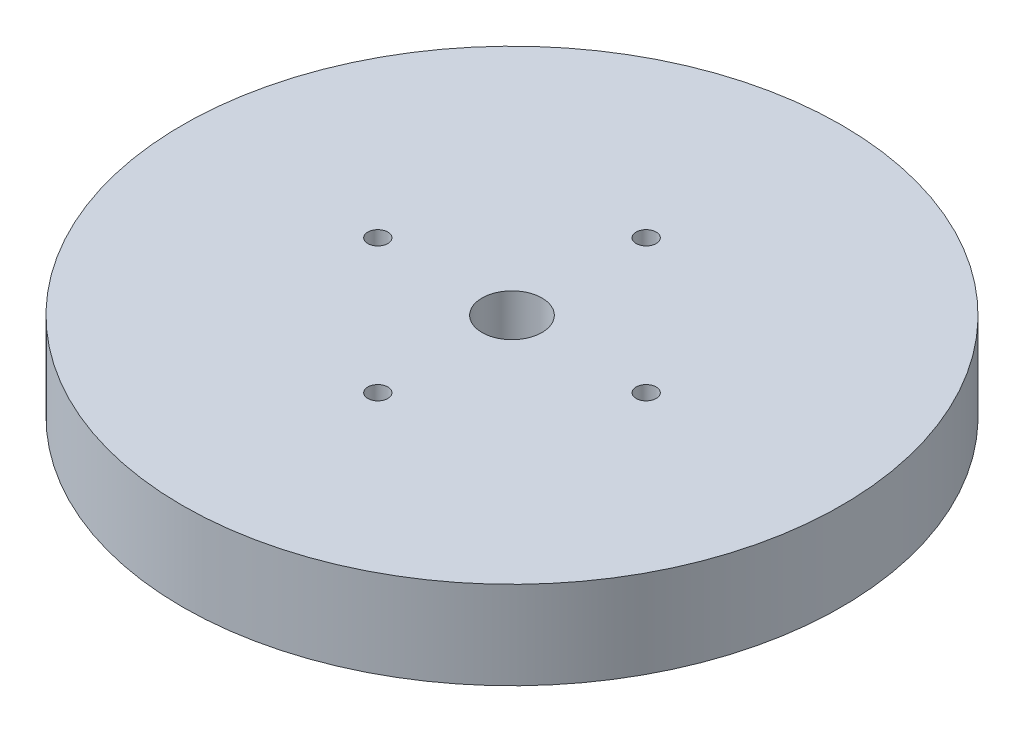
from build123d import *

# Parameters (mm, degrees)
SKETCH1_R           = 82.5
BOSS_EXTRUDE1_DEPTH = 22
SKETCH2_R           = 7.5
CUT_EXTRUDE1_DEPTH  = 119.728682297
SKETCH3_R           = 2.506035233
CUT_EXTRUDE2_DEPTH  = 15.316390653
CIRPATTERN1_COUNT   = 4


with BuildPart() as part:
    # Sketch1 → Boss-Extrude1 (new body)
    with BuildSketch(Plane(origin=(0, 0, 0), x_dir=(1, 0, 0), z_dir=(0, 1, 0))):
        Circle(SKETCH1_R)
    extrude(amount=BOSS_EXTRUDE1_DEPTH)

    # Sketch2 → Cut-Extrude1 (cut, through all)
    with BuildSketch(Plane(origin=(0, 0, 0), x_dir=(1, 0, 0), z_dir=(0, 1, 0))):
        Circle(SKETCH2_R)
    extrude(amount=CUT_EXTRUDE1_DEPTH, mode=Mode.SUBTRACT)

    # Sketch3 → Cut-Extrude2 (cut)
    with BuildSketch(Plane(origin=(0, 22, 0), x_dir=(1, 0, 0), z_dir=(0, 1, 0))):
        with Locations((-33.586704901, 0)):
            Circle(SKETCH3_R)
    cut_extrude2 = extrude(amount=-CUT_EXTRUDE2_DEPTH, mode=Mode.SUBTRACT)

    # CirPattern1: Cut-Extrude2 ×4 about axis
    cirpattern1_axis = Axis((0, 0, 0), (0, 1, 0))
    for i in range(1, CIRPATTERN1_COUNT):
        add(cut_extrude2.rotate(cirpattern1_axis, i * 360 / CIRPATTERN1_COUNT), mode=Mode.SUBTRACT)


solid = part.part
